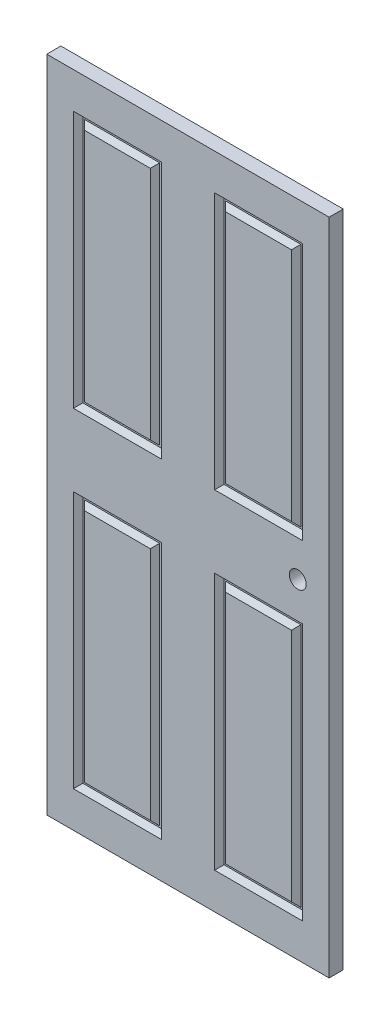
from build123d import *

# Parameters (mm, degrees)
SKETCH1_W                  = 900
SKETCH1_H                  = 2100
BOSS_EXTRUDE1_DEPTH        = 22.5
SKETCH2_W                  = 250
SKETCH2_H                  = 790
SKETCH2_W_2                = 240
SKETCH2_H_2                = 780
CUT_EXTRUDE1_DEPTH         = 15
CHAMFER1_SIZE              = 15
CHAMFER1_OF_MIRROR1_SIZE   = 15
MIRROR2_OUTLINE_W          = 250
MIRROR2_OUTLINE_H          = 790
MIRROR2_OUTLINE_W_2        = 240
MIRROR2_OUTLINE_H_2        = 780
MIRROR2_DEPTH              = 15
MIRROR2_DRAFT              = -45
MIRROR2_2_OUTLINE_W        = 250
MIRROR2_2_OUTLINE_H        = 790
MIRROR2_2_OUTLINE_W_2      = 240
MIRROR2_2_OUTLINE_H_2      = 780
MIRROR2_2_DEPTH            = 15
MIRROR2_2_DRAFT            = -45
CHAMFER2_SIZE              = 15
MIRROR10_COPY_1_SKETCH_W   = 250
MIRROR10_COPY_1_SKETCH_H   = 790
MIRROR10_COPY_1_SKETCH_W_2 = 240
MIRROR10_COPY_1_SKETCH_H_2 = 780
MIRROR10_COPY_1_DEPTH      = 15
MIRROR10_COPY_2_SKETCH_W   = 250
MIRROR10_COPY_2_SKETCH_H   = 790
MIRROR10_COPY_2_SKETCH_W_2 = 240
MIRROR10_COPY_2_SKETCH_H_2 = 780
MIRROR10_COPY_2_DEPTH      = 15
CHAMFER2_OF_MIRROR10_SIZE  = 15
MIRROR11_OUTLINE_W         = 250
MIRROR11_OUTLINE_H         = 790
MIRROR11_OUTLINE_W_2       = 240
MIRROR11_OUTLINE_H_2       = 780
MIRROR11_DEPTH             = 15
MIRROR11_DRAFT             = 45
MIRROR11_2_OUTLINE_W       = 250
MIRROR11_2_OUTLINE_H       = 790
MIRROR11_2_OUTLINE_W_2     = 240
MIRROR11_2_OUTLINE_H_2     = 780
MIRROR11_2_DEPTH           = 15
MIRROR11_2_DRAFT           = 45
SKETCH4_R                  = 27
CUT_EXTRUDE2_DEPTH         = 45


# Read off the part's stored shape, not the designer's step: Mirror2, Mirror11
with BuildPart() as part:
    # Sketch1 → Boss-Extrude1 (new, symmetric)
    with BuildSketch(Plane.XY):
        Rectangle(SKETCH1_W, SKETCH1_H)
    extrude(amount=BOSS_EXTRUDE1_DEPTH, both=True)

    # Sketch2 → Cut-Extrude1 (cut)
    with BuildSketch(Plane.XY.offset(22.5)):
        with Locations((-225, 525)):
            Rectangle(SKETCH2_W, SKETCH2_H)
        with Locations((-225, 525)):
            Rectangle(SKETCH2_W_2, SKETCH2_H_2, mode=Mode.SUBTRACT)
    cut_extrude1 = extrude(amount=-CUT_EXTRUDE1_DEPTH, mode=Mode.SUBTRACT)

    # Chamfer1
    chamfer1_edges = [part.edges().sort_by_distance(p)[0] for p in [
        (-225, 915, 22.5),
        (-105, 525, 22.5),
        (-345, 525, 22.5),
        (-225, 135, 22.5),
        (-225, 920, 22.5),
        (-100, 525, 22.5),
        (-225, 130, 22.5),
        (-350, 525, 22.5),
    ]]
    chamfer(chamfer1_edges, length=CHAMFER1_SIZE - 0.0001)  # a hair under: the kernel refuses the full size

    # Mirror1: Cut-Extrude1 across plane
    add(cut_extrude1.mirror(Plane(origin=(0, 0, 0), x_dir=(0, 0, 1), z_dir=(1, 0, 0))), mode=Mode.SUBTRACT)

    # Chamfer1 of Mirror1
    chamfer1_of_mirror1_edges = [part.edges().sort_by_distance(p)[0] for p in [
        (225, 915, 22.5),
        (105, 525, 22.5),
        (345, 525, 22.5),
        (225, 135, 22.5),
        (225, 920, 22.5),
        (100, 525, 22.5),
        (225, 130, 22.5),
        (350, 525, 22.5),
    ]]
    chamfer(chamfer1_of_mirror1_edges, length=CHAMFER1_OF_MIRROR1_SIZE - 0.0001)  # a hair under: the kernel refuses the full size


with BuildPart() as mirror2_tool:
    # Mirror2 outline → Mirror2 (with draft: the straight prism first)
    with BuildSketch(Plane.XY.offset(7.5)):
        with Locations((-225, -525)):
            Rectangle(MIRROR2_OUTLINE_W, MIRROR2_OUTLINE_H)
        with Locations((-225, -525)):
            Rectangle(MIRROR2_OUTLINE_W_2, MIRROR2_OUTLINE_H_2, mode=Mode.SUBTRACT)
    extrude(amount=MIRROR2_DEPTH)
    # Mirror2: the draft: its side faces are tilted about the plane it starts from
    mirror2_sides = [mirror2_tool.faces().sort_by_distance(p)[0] for p in [
        (-350, -525, 15),
        (-225, -920, 15),
        (-100, -525, 15),
        (-225, -130, 15),
        (-225, -915, 15),
        (-345, -525, 15),
        (-225, -135, 15),
        (-105, -525, 15),
    ]]
    draft(mirror2_sides, Plane.XY.offset(7.5), MIRROR2_DRAFT)


with BuildPart() as part_1:
    add(part.part)

    # Mirror2: cut by mirror2_tool
    add(mirror2_tool.part, mode=Mode.SUBTRACT)


with BuildPart() as mirror2_2_tool:
    # Mirror2 2 outline → Mirror2 2 (with draft: the straight prism first)
    with BuildSketch(Plane.XY.offset(7.5)):
        with Locations((225, -525)):
            Rectangle(MIRROR2_2_OUTLINE_W, MIRROR2_2_OUTLINE_H)
        with Locations((225, -525)):
            Rectangle(MIRROR2_2_OUTLINE_W_2, MIRROR2_2_OUTLINE_H_2, mode=Mode.SUBTRACT)
    extrude(amount=MIRROR2_2_DEPTH)
    # Mirror2 2: the draft: its side faces are tilted about the plane it starts from
    mirror2_2_sides = [mirror2_2_tool.faces().sort_by_distance(p)[0] for p in [
        (350, -525, 15),
        (225, -130, 15),
        (100, -525, 15),
        (225, -920, 15),
        (105, -525, 15),
        (225, -135, 15),
        (345, -525, 15),
        (225, -915, 15),
    ]]
    draft(mirror2_2_sides, Plane.XY.offset(7.5), MIRROR2_2_DRAFT)


with BuildPart() as part_2:
    add(part_1.part)

    # Mirror2 2: cut by mirror2_2_tool
    add(mirror2_2_tool.part, mode=Mode.SUBTRACT)

    # Mirror5: Cut-Extrude1 across plane
    add(cut_extrude1.mirror(Plane.XY), mode=Mode.SUBTRACT)

    # Chamfer2
    chamfer2_edges = [part_2.edges().sort_by_distance(p)[0] for p in [
        (-225, 130, -22.5),
        (-350, 525, -22.5),
        (-100, 525, -22.5),
        (-225, 920, -22.5),
        (-225, 135, -22.5),
        (-345, 525, -22.5),
        (-105, 525, -22.5),
        (-225, 915, -22.5),
    ]]
    chamfer(chamfer2_edges, length=CHAMFER2_SIZE - 0.0001)  # a hair under: the kernel refuses the full size

    # Mirror10 copy 1 sketch → Mirror10 copy 1 (cut)
    with BuildSketch(Plane(origin=(0, 0, -22.5), x_dir=(-1, 0, 0), z_dir=(0, 0, -1))):
        with Locations((-225, 525)):
            Rectangle(MIRROR10_COPY_1_SKETCH_W, MIRROR10_COPY_1_SKETCH_H)
        with Locations((-225, 525)):
            Rectangle(MIRROR10_COPY_1_SKETCH_W_2, MIRROR10_COPY_1_SKETCH_H_2, mode=Mode.SUBTRACT)
    extrude(amount=-MIRROR10_COPY_1_DEPTH, mode=Mode.SUBTRACT)

    # Mirror10 copy 2 sketch → Mirror10 copy 2 (cut)
    with BuildSketch(Plane(origin=(0, 0, 22.5), x_dir=(-1, 0, 0), z_dir=(0, 0, 1))):
        with Locations((-225, -525)):
            Rectangle(MIRROR10_COPY_2_SKETCH_W, MIRROR10_COPY_2_SKETCH_H)
        with Locations((-225, -525)):
            Rectangle(MIRROR10_COPY_2_SKETCH_W_2, MIRROR10_COPY_2_SKETCH_H_2, mode=Mode.SUBTRACT)
    extrude(amount=-MIRROR10_COPY_2_DEPTH, mode=Mode.SUBTRACT)

    # Chamfer2 of Mirror10
    chamfer2_of_mirror10_edges = [part_2.edges().sort_by_distance(p)[0] for p in [
        (225, 130, -22.5),
        (350, 525, -22.5),
        (100, 525, -22.5),
        (225, 920, -22.5),
        (225, 135, -22.5),
        (345, 525, -22.5),
        (105, 525, -22.5),
        (225, 915, -22.5),
    ]]
    chamfer(chamfer2_of_mirror10_edges, length=CHAMFER2_OF_MIRROR10_SIZE - 0.0001)  # a hair under: the kernel refuses the full size


with BuildPart() as mirror11_tool:
    # Mirror11 outline → Mirror11 (with draft: the straight prism first)
    with BuildSketch(Plane.XY.offset(-7.5)):
        with Locations((-225, -525)):
            Rectangle(MIRROR11_OUTLINE_W, MIRROR11_OUTLINE_H)
        with Locations((-225, -525)):
            Rectangle(MIRROR11_OUTLINE_W_2, MIRROR11_OUTLINE_H_2, mode=Mode.SUBTRACT)
    extrude(amount=-MIRROR11_DEPTH)
    # Mirror11: the draft: its side faces are tilted about the plane it starts from
    mirror11_sides = [mirror11_tool.faces().sort_by_distance(p)[0] for p in [
        (-225, -920, -15),
        (-100, -525, -15),
        (-225, -130, -15),
        (-350, -525, -15),
        (-225, -915, -15),
        (-345, -525, -15),
        (-225, -135, -15),
        (-105, -525, -15),
    ]]
    draft(mirror11_sides, Plane.XY.offset(-7.5), MIRROR11_DRAFT)


with BuildPart() as part_3:
    add(part_2.part)

    # Mirror11: cut by mirror11_tool
    add(mirror11_tool.part, mode=Mode.SUBTRACT)


with BuildPart() as mirror11_2_tool:
    # Mirror11 2 outline → Mirror11 2 (with draft: the straight prism first)
    with BuildSketch(Plane.XY.offset(-7.5)):
        with Locations((225, -525)):
            Rectangle(MIRROR11_2_OUTLINE_W, MIRROR11_2_OUTLINE_H)
        with Locations((225, -525)):
            Rectangle(MIRROR11_2_OUTLINE_W_2, MIRROR11_2_OUTLINE_H_2, mode=Mode.SUBTRACT)
    extrude(amount=-MIRROR11_2_DEPTH)
    # Mirror11 2: the draft: its side faces are tilted about the plane it starts from
    mirror11_2_sides = [mirror11_2_tool.faces().sort_by_distance(p)[0] for p in [
        (225, -130, -15),
        (100, -525, -15),
        (225, -920, -15),
        (350, -525, -15),
        (105, -525, -15),
        (225, -135, -15),
        (345, -525, -15),
        (225, -915, -15),
    ]]
    draft(mirror11_2_sides, Plane.XY.offset(-7.5), MIRROR11_2_DRAFT)


with BuildPart() as part_4:
    add(part_3.part)

    # Mirror11 2: cut by mirror11_2_tool
    add(mirror11_2_tool.part, mode=Mode.SUBTRACT)

    # Sketch4 → Cut-Extrude2 (cut)
    with BuildSketch(Plane.XY.offset(22.5)):
        with Locations((350, 0)):
            Circle(SKETCH4_R)
    extrude(amount=-CUT_EXTRUDE2_DEPTH, mode=Mode.SUBTRACT)


solid = part_4.part
